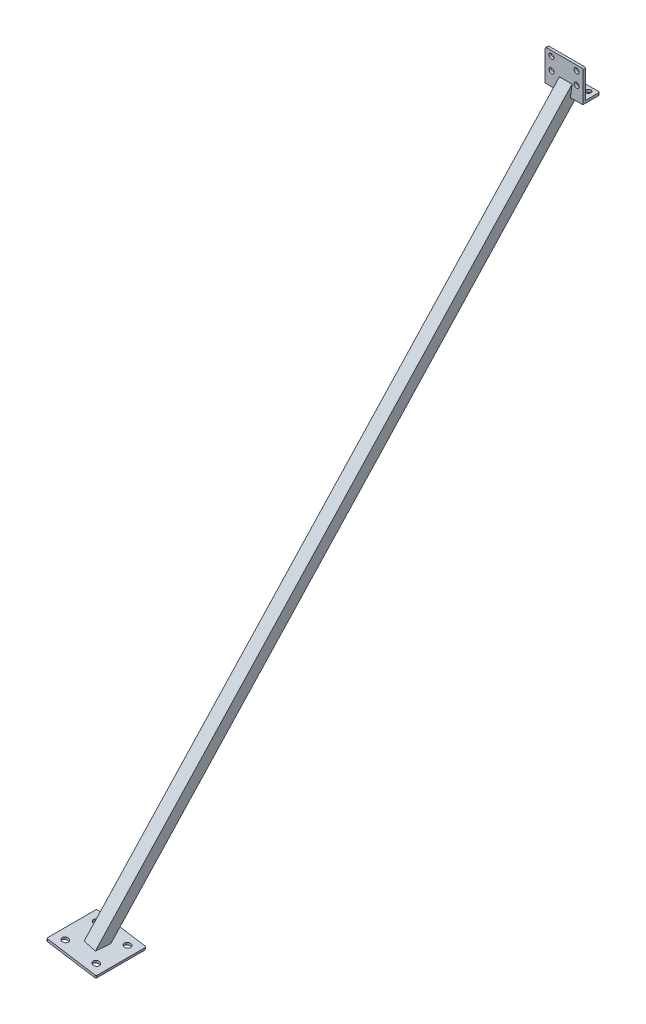
from build123d import *

# Parameters (mm, degrees)
BOSS_EXTRUDE1_DEPTH      = 60
BOSS_EXTRUDE2_DEPTH      = 2000
BOSS_EXTRUDE2_DEPTH_BACK = 20
SKETCH3_W                = 20
SKETCH3_H                = 20
SKETCH3_W_2              = 18
SKETCH3_H_2              = 18
CUT_EXTRUDE1_DEPTH       = 60
SKETCH6_W                = 80
SKETCH6_H                = 80
BOSS_EXTRUDE3_DEPTH      = 4
SKETCH7_W                = 155.890708873
SKETCH7_H                = 491.291930993
CUT_EXTRUDE2_DEPTH       = 1000
CUT_EXTRUDE3_REACH       = 1177.693
SKETCH8_R                = 3.999999996
CUT_EXTRUDE4_REACH       = 1177.693
SKETCH9_R                = 4.000000003
CUT_EXTRUDE5_REACH       = 1218.32
SKETCH10_R               = 5
FILLET1_R                = 2
FILLET2_R                = 2


with BuildPart() as part:
    # Sketch1 → Boss-Extrude1 (new body)
    with BuildSketch(Plane(origin=(0, 0, 0), x_dir=(0, 0, -1), z_dir=(1, 0, 0))):
        Polygon((0, 0), (0, 50), (4, 50), (4, 4), (27, 4), (27, 0), align=None)
    extrude(amount=BOSS_EXTRUDE1_DEPTH)

    # Sketch3 → Boss-Extrude2 (add, two sides: drawn at the far end of the back side and taken through both)
    with BuildSketch(Plane(origin=(0.734152256, 4.01424851, -2.317627458), x_dir=(0, -0.5000000000000011, -0.8660254037844382), z_dir=(-0.15643446504023129, -0.8553631939770857, 0.49384417029756994)).offset(-BOSS_EXTRUDE2_DEPTH_BACK)):
        with Locations((0, 29.630650218)):
            Rectangle(SKETCH3_W, SKETCH3_H)
        with Locations((0, 29.630650218)):
            Rectangle(SKETCH3_W_2, SKETCH3_H_2, mode=Mode.SUBTRACT)
    extrude(amount=BOSS_EXTRUDE2_DEPTH + BOSS_EXTRUDE2_DEPTH_BACK)

    # Sketch4 → Cut-Extrude1 (cut)
    with BuildSketch(Plane.ZY):
        Polygon((-4, 4), (-4, 34.425897354), (-31.384039134, 4), align=None)
    extrude(amount=-CUT_EXTRUDE1_DEPTH, mode=Mode.SUBTRACT)

    # Sketch6 → Boss-Extrude3 (add)
    with BuildSketch(Plane(origin=(-155.547262091, -982.086761679, 2e-09), x_dir=(0.9876883405962853, -0.15643446503298522, 2.850074130140165e-13), z_dir=(0.15643446503298522, 0.9876883405962853, -1.7994659856963005e-12))):
        with Locations((5.477031179, -566.441418586)):
            Rectangle(SKETCH6_W, SKETCH6_H)
    extrude(amount=BOSS_EXTRUDE3_DEPTH)

    # Sketch7 → Cut-Extrude2 (cut)
    with BuildSketch(Plane(origin=(-155.547262091, -982.086761679, 2e-09), x_dir=(0.9876883405962853, -0.15643446503298547, -2.6345367909155185e-10), z_dir=(-0.15643446503298547, -0.9876883405962853, 1.7997198054105393e-12))):
        with Locations((-7.001123273, 786.089826429)):
            Rectangle(SKETCH7_W, SKETCH7_H)
    extrude(amount=CUT_EXTRUDE2_DEPTH, mode=Mode.SUBTRACT)

    # Sketch8 → Cut-Extrude3 (cut, up to next)
    with BuildSketch(Plane.XY, mode=Mode.PRIVATE) as cut_extrude3_sk1:
        with Locations((10, 22)):
            Circle(SKETCH8_R)
    cut_extrude3_tool1 = extrude(cut_extrude3_sk1.sketch, amount=-CUT_EXTRUDE3_REACH, mode=Mode.PRIVATE) & part.part
    # Sketch8 → Cut-Extrude3 (cut, up to next)
    with BuildSketch(Plane.XY, mode=Mode.PRIVATE) as cut_extrude3_sk2:
        with Locations((50, 22)):
            Circle(SKETCH8_R)
    cut_extrude3_tool2 = extrude(cut_extrude3_sk2.sketch, amount=-CUT_EXTRUDE3_REACH, mode=Mode.PRIVATE) & part.part
    # Sketch8 → Cut-Extrude3 (cut, up to next)
    with BuildSketch(Plane.XY, mode=Mode.PRIVATE) as cut_extrude3_sk3:
        with Locations((50, 42)):
            Circle(SKETCH8_R)
    cut_extrude3_tool3 = extrude(cut_extrude3_sk3.sketch, amount=-CUT_EXTRUDE3_REACH, mode=Mode.PRIVATE) & part.part
    # Sketch8 → Cut-Extrude3 (cut, up to next)
    with BuildSketch(Plane.XY, mode=Mode.PRIVATE) as cut_extrude3_sk4:
        with Locations((10, 42)):
            Circle(SKETCH8_R)
    cut_extrude3_tool4 = extrude(cut_extrude3_sk4.sketch, amount=-CUT_EXTRUDE3_REACH, mode=Mode.PRIVATE) & part.part
    add(cut_extrude3_tool1.solids().sort_by_distance((10, 22, 0))[0], mode=Mode.SUBTRACT)
    add(cut_extrude3_tool2.solids().sort_by_distance((50, 22, 0))[0], mode=Mode.SUBTRACT)
    add(cut_extrude3_tool3.solids().sort_by_distance((50, 42, 0))[0], mode=Mode.SUBTRACT)
    add(cut_extrude3_tool4.solids().sort_by_distance((10, 42, 0))[0], mode=Mode.SUBTRACT)

    # Sketch9 → Cut-Extrude4 (cut, up to next)
    with BuildSketch(Plane.XZ, mode=Mode.PRIVATE) as cut_extrude4_sk1:
        with Locations((50, -19)):
            Circle(SKETCH9_R)
    cut_extrude4_tool1 = extrude(cut_extrude4_sk1.sketch, amount=-CUT_EXTRUDE4_REACH, mode=Mode.PRIVATE) & part.part
    # Sketch9 → Cut-Extrude4 (cut, up to next)
    with BuildSketch(Plane.XZ, mode=Mode.PRIVATE) as cut_extrude4_sk2:
        with Locations((10, -19)):
            Circle(SKETCH9_R)
    cut_extrude4_tool2 = extrude(cut_extrude4_sk2.sketch, amount=-CUT_EXTRUDE4_REACH, mode=Mode.PRIVATE) & part.part
    add(cut_extrude4_tool1.solids().sort_by_distance((50, 0, -19))[0], mode=Mode.SUBTRACT)
    add(cut_extrude4_tool2.solids().sort_by_distance((10, 0, -19))[0], mode=Mode.SUBTRACT)

    # Sketch10 → Cut-Extrude5 (cut, up to next)
    with BuildSketch(Plane(origin=(-155.547262091, -982.086761679, 2e-09), x_dir=(0.9876883405962853, -0.15643446503298547, -2.6345367909155185e-10), z_dir=(-0.15643446503298547, -0.9876883405962853, 1.7997198054105329e-12)), mode=Mode.PRIVATE) as cut_extrude5_sk1:
        with Locations((-19.52296896, 591.441418577)):
            Circle(SKETCH10_R)
    cut_extrude5_tool1 = extrude(cut_extrude5_sk1.sketch, amount=-CUT_EXTRUDE5_REACH, mode=Mode.PRIVATE) & part.part
    # Sketch10 → Cut-Extrude5 (cut, up to next)
    with BuildSketch(Plane(origin=(-155.547262091, -982.086761679, 2e-09), x_dir=(0.9876883405962853, -0.15643446503298547, -2.6345367909155185e-10), z_dir=(-0.15643446503298547, -0.9876883405962853, 1.7997198054105329e-12)), mode=Mode.PRIVATE) as cut_extrude5_sk2:
        with Locations((30.47703104, 591.441418577)):
            Circle(SKETCH10_R)
    cut_extrude5_tool2 = extrude(cut_extrude5_sk2.sketch, amount=-CUT_EXTRUDE5_REACH, mode=Mode.PRIVATE) & part.part
    # Sketch10 → Cut-Extrude5 (cut, up to next)
    with BuildSketch(Plane(origin=(-155.547262091, -982.086761679, 2e-09), x_dir=(0.9876883405962853, -0.15643446503298547, -2.6345367909155185e-10), z_dir=(-0.15643446503298547, -0.9876883405962853, 1.7997198054105329e-12)), mode=Mode.PRIVATE) as cut_extrude5_sk3:
        with Locations((30.47703104, 541.441418577)):
            Circle(SKETCH10_R)
    cut_extrude5_tool3 = extrude(cut_extrude5_sk3.sketch, amount=-CUT_EXTRUDE5_REACH, mode=Mode.PRIVATE) & part.part
    # Sketch10 → Cut-Extrude5 (cut, up to next)
    with BuildSketch(Plane(origin=(-155.547262091, -982.086761679, 2e-09), x_dir=(0.9876883405962853, -0.15643446503298547, -2.6345367909155185e-10), z_dir=(-0.15643446503298547, -0.9876883405962853, 1.7997198054105329e-12)), mode=Mode.PRIVATE) as cut_extrude5_sk4:
        with Locations((-19.52296896, 541.441418577)):
            Circle(SKETCH10_R)
    cut_extrude5_tool4 = extrude(cut_extrude5_sk4.sketch, amount=-CUT_EXTRUDE5_REACH, mode=Mode.PRIVATE) & part.part
    add(cut_extrude5_tool1.solids().sort_by_distance((-174.829871, -979.032696, 591.441419))[0], mode=Mode.SUBTRACT)
    add(cut_extrude5_tool2.solids().sort_by_distance((-125.445454, -986.85442, 591.441419))[0], mode=Mode.SUBTRACT)
    add(cut_extrude5_tool3.solids().sort_by_distance((-125.445454, -986.85442, 541.441419))[0], mode=Mode.SUBTRACT)
    add(cut_extrude5_tool4.solids().sort_by_distance((-174.829871, -979.032696, 541.441419))[0], mode=Mode.SUBTRACT)

    # Fillet1
    fillet1_edges = [part.edges().sort_by_distance(p)[0] for p in [
        (-189.332326949, -974.710802838, 606.441418588),
        (-189.332326949, -974.710802838, 526.441418588),
        (-110.317259701, -987.225560041, 526.441418588),
        (-110.317259701, -987.225560041, 606.441418588),
    ]]
    fillet(fillet1_edges, radius=FILLET1_R)

    # Fillet2
    fillet2_edges = [part.edges().sort_by_distance(p)[0] for p in [
        (60, 2, -27),
        (0, 2, -27),
        (60, 50, -2),
        (0, 50, -2),
    ]]
    fillet(fillet2_edges, radius=FILLET2_R)


solid = part.part
